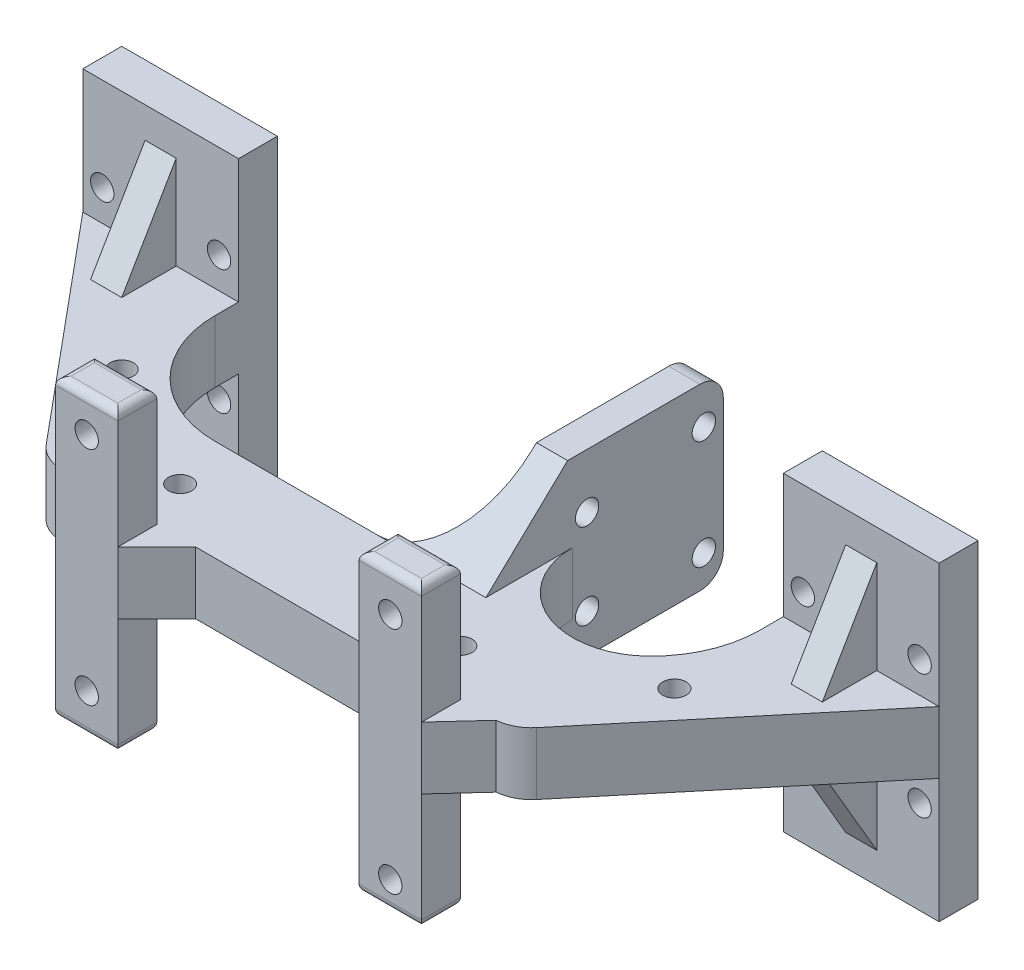
from build123d import *

# Parameters (mm, degrees)
SKETCH_1_W           = 20
SKETCH_1_H           = 39.9
SKETCH_1_R           = 1.5
EXTRUDE_1_DEPTH      = 5
EXTRUDE_1_2_DEPTH    = 5
EXTRUDE_2_DEPTH      = 4
EXTRUDE_2_DEPTH_BACK = 4
FILLET_1_R           = 14
SKETCH_3_R           = 1.5
CUT_EXTRUDE_1_DEPTH  = 11
FILLET_2_R           = 5
SKETCH_4_W           = 4
SKETCH_4_H           = 12
EXTRUDE_3_DEPTH      = 7
CUT_EXTRUDE_2_DEPTH  = 148
EXTRUDE_4_DEPTH      = 4
EXTRUDE_4_DEPTH_BACK = 8
SKETCH_6_W           = 4
SKETCH_6_H           = 30.5
SKETCH_10_W          = 20
SKETCH_10_H          = 6
SKETCH_10_H_2        = 5
EXTRUDE_6_DEPTH      = 4
CUT_EXTRUDE_5_DEPTH  = 6
SKETCH_13_R          = 1.5
CUT_EXTRUDE_6_DEPTH  = 6
EXTRUDE_8_DEPTH      = 4
SKETCH_19_W          = 8
SKETCH_19_H          = 15
SKETCH_19_R          = 1.5
SKETCH_19_H_2        = 8
EXTRUDE_9_DEPTH      = 5
CHAMFER_START        = -4
CHAMFER_1_DEPTH      = 8
FILLET_13_R          = 1
FILLET_14_R          = 10
FILLET_15_R          = 3


with BuildPart() as part:
    # 草图1 → 凸台-拉伸1 (new body)
    with BuildSketch(Plane.XY):
        with Locations((45, 0)):
            Rectangle(SKETCH_1_W, SKETCH_1_H)
        with Locations((37.5, 8)):
            Circle(SKETCH_1_R, mode=Mode.SUBTRACT)
        with Locations(Location((52.5, 8, 0), (0, 0, 180))):
            Circle(SKETCH_1_R, mode=Mode.SUBTRACT)
        with Locations((52.5, -8)):
            Circle(SKETCH_1_R, mode=Mode.SUBTRACT)
        with Locations(Location((37.5, -8, 0), (0, 0, 180))):
            Circle(SKETCH_1_R, mode=Mode.SUBTRACT)
    extrude(amount=EXTRUDE_1_DEPTH)



with BuildPart() as body_2:
    # 草图1 → Extrude 1 2 (new body)
    with BuildSketch(Plane.XY):
        with Locations((-45, 0)):
            Rectangle(SKETCH_1_W, SKETCH_1_H)
        with Locations((-37.5, -8)):
            Circle(SKETCH_1_R, mode=Mode.SUBTRACT)
        with Locations(Location((-52.5, -8, 0), (0, 0, 180))):
            Circle(SKETCH_1_R, mode=Mode.SUBTRACT)
        with Locations((-52.5, 8)):
            Circle(SKETCH_1_R, mode=Mode.SUBTRACT)
        with Locations(Location((-37.5, 8, 0), (0, 0, 180))):
            Circle(SKETCH_1_R, mode=Mode.SUBTRACT)
    extrude(amount=EXTRUDE_1_2_DEPTH)


with BuildPart() as part_1:
    add(part.part)

    add(body_2.part)  # 凸台-拉伸2 merges body 2
    # 草图2 → 凸台-拉伸2 (add, two sides: drawn at the far end of the back side and taken through both)
    with BuildSketch(Plane(origin=(0, 0, 0), x_dir=(1, 0, 0), z_dir=(0, 1, 0)).offset(-EXTRUDE_2_DEPTH_BACK)):
        Polygon((-35, -5), (-55, -5), (-30, -35), (30, -35), (55, -5), (35, -5), (35, -22), (-35, -22), align=None)
    extrude(amount=EXTRUDE_2_DEPTH + EXTRUDE_2_DEPTH_BACK)

    # 圆角1
    fillet_1_edges = [part_1.edges().sort_by_distance(p)[0] for p in [
        (-35, 0, 22),
        (35, 0, 22),
    ]]
    fillet(fillet_1_edges, radius=FILLET_1_R)

    # 草图3 → 切除-拉伸1 (cut)
    with BuildSketch(Plane(origin=(0, 4, 0), x_dir=(1, 0, 0), z_dir=(0, 1, 0))):
        with Locations(Location((17.5, -29, 0), (0, 0, 270))):
            Circle(SKETCH_3_R)
        with Locations(Location((-18.5, -29, 0), (0, 0, 270))):
            Circle(SKETCH_3_R)
        with Locations(Location((-35, -20, 0), (0, 0, 270))):
            Circle(SKETCH_3_R)
        with Locations(Location((36, -20, 0), (0, 0, 270))):
            Circle(SKETCH_3_R)
    extrude(amount=-CUT_EXTRUDE_1_DEPTH, mode=Mode.SUBTRACT)

    # 圆角2
    fillet_2_edges = [part_1.edges().sort_by_distance(p)[0] for p in [
        (30, 0, 35),
        (-30, 0, 35),
    ]]
    fillet(fillet_2_edges, radius=FILLET_2_R)

    # 草图4 → 凸台-拉伸3 (add)
    with BuildSketch(Plane.XY.offset(5)):
        with Locations((-45, 10)):
            Rectangle(SKETCH_4_W, SKETCH_4_H)
        with Locations((-45, -10)):
            Rectangle(SKETCH_4_W, SKETCH_4_H)
        with Locations((45, -10)):
            Rectangle(SKETCH_4_W, SKETCH_4_H)
        with Locations((45, 10)):
            Rectangle(SKETCH_4_W, SKETCH_4_H)
    extrude(amount=EXTRUDE_3_DEPTH)

    # 草图5 → 切除-拉伸2 (cut)
    with BuildSketch(Plane.ZY.offset(47)):
        Polygon((5, 16), (12, 16), (12, 4), align=None)
        Polygon((12, -16), (12, -4), (5, -16), align=None)
    extrude(amount=-CUT_EXTRUDE_2_DEPTH, mode=Mode.SUBTRACT)

    # 草图6 → 凸台-拉伸4 (add, two sides: drawn at the far end of the back side and taken through both)
    with BuildSketch(Plane(origin=(0, 4, 0), x_dir=(1, 0, 0), z_dir=(0, 1, 0)).offset(-EXTRUDE_4_DEPTH_BACK)):
        with Locations((11.78, -6.75)):
            Rectangle(SKETCH_6_W, SKETCH_6_H)
    extrude(amount=EXTRUDE_4_DEPTH + EXTRUDE_4_DEPTH_BACK)

    # 草图10 → 凸台-拉伸6 (add)
    with BuildSketch(Plane(origin=(13.78, 0, 0), x_dir=(0, 0, -1), z_dir=(1, 0, 0))):
        with Locations((-1.5, 11)):
            Rectangle(SKETCH_10_W, SKETCH_10_H)
        with Locations((-1.5, -6.5)):
            Rectangle(SKETCH_10_W, SKETCH_10_H_2)
    extrude(amount=-EXTRUDE_6_DEPTH)

    # 草图11 → 切除-拉伸5 (cut)
    with BuildSketch(Plane.ZY.offset(-9.78)):
        Polygon((17.8, 8), (22, 8), (22, 4), align=None)
    extrude(amount=-CUT_EXTRUDE_5_DEPTH, mode=Mode.SUBTRACT)

    # 草图13 → 切除-拉伸6 (cut)
    with BuildSketch(Plane(origin=(13.78, 0, 0), x_dir=(0, 0, -1), z_dir=(1, 0, 0))):
        with Locations((6, 9)):
            Circle(SKETCH_13_R)
        with Locations((6, -5)):
            Circle(SKETCH_13_R)
        with Locations((-9, 7)):
            Circle(SKETCH_13_R)
        with Locations((-9, -4)):
            Circle(SKETCH_13_R)
    extrude(amount=-CUT_EXTRUDE_6_DEPTH, mode=Mode.SUBTRACT)

    # 草图18 → 凸台-拉伸8 (add)
    with BuildSketch(Plane(origin=(13.78, 0, 0), x_dir=(0, 0, -1), z_dir=(1, 0, 0))):
        Polygon((-11.5, -9), (-11.5, -4), (-22.5, -4), align=None)
        Polygon((-17.8, 8), (-11.5, 14), (-11.5, 8), align=None)
    extrude(amount=-EXTRUDE_8_DEPTH)

    # 草图19 → 凸台-拉伸9 (add)
    # profile 1 of 6: a face of its own
    with BuildSketch(Plane.XY.offset(35)):
        with Locations((-19.5, 11.5)):
            Rectangle(SKETCH_19_W, SKETCH_19_H)
        with Locations((-19.5, 14.5)):
            Circle(SKETCH_19_R, mode=Mode.SUBTRACT)
    # profile 2 of 6: a face of its own
    with BuildSketch(Plane.XY.offset(35)):
        with Locations((-19.5, 0)):
            Rectangle(SKETCH_19_W, SKETCH_19_H_2)
    # profile 3 of 6: a face of its own
    with BuildSketch(Plane.XY.offset(35)):
        with Locations((-19.5, -11.5)):
            Rectangle(SKETCH_19_W, SKETCH_19_H)
        with Locations((-19.5, -14)):
            Circle(SKETCH_19_R, mode=Mode.SUBTRACT)
    # profile 4 of 6: a face of its own
    with BuildSketch(Plane.XY.offset(35)):
        with Locations((19.5, 11.5)):
            Rectangle(SKETCH_19_W, SKETCH_19_H)
        with Locations((19.5, 14)):
            Circle(SKETCH_19_R, mode=Mode.SUBTRACT)
    # profile 5 of 6: a face of its own
    with BuildSketch(Plane.XY.offset(35)):
        with Locations((19.5, 0)):
            Rectangle(SKETCH_19_W, SKETCH_19_H_2)
    # profile 6 of 6: a face of its own
    with BuildSketch(Plane.XY.offset(35)):
        with Locations((19.5, -11.5)):
            Rectangle(SKETCH_19_W, SKETCH_19_H)
        with Locations((19.5, -15.5)):
            Circle(SKETCH_19_R, mode=Mode.SUBTRACT)
    extrude(amount=EXTRUDE_9_DEPTH)

    # 倒角1: read off the stored shape, not the designer's step
    # 倒角1 outline → 倒角1 (add)
    with BuildSketch(Plane(origin=(0, 0, 0), x_dir=(1, 0, 0), z_dir=(0, 1, 0)).offset(CHAMFER_START)):
        with BuildLine():
            Line((23.5, -39.964499332), (28.079062635, -34.982249666))
            ThreePointArc((28.079062635, -34.982249666), (27.868780996, -34.995560446), (27.65812527, -35))
            Line((27.65812527, -35), (23.5, -35))
            Line((23.5, -35), (23.5, -39.964499332))
        make_face()
        with BuildLine():
            Line((-28.079062635, -34.982249666), (-23.5, -39.964499332))
            Line((-23.5, -39.964499332), (-23.5, -35))
            Line((-23.5, -35), (-27.65812527, -35))
            ThreePointArc((-27.65812527, -35), (-27.868780996, -34.995560446), (-28.079062635, -34.982249666))
        make_face()
        Polygon((15.5, -35), (10.5, -35), (15.5, -40), align=None)
        Polygon((-15.5, -40), (-10.5, -35), (-15.5, -35), align=None)
    extrude(amount=CHAMFER_1_DEPTH)

    # 圆角13
    fillet_13_edges = [part_1.edges().sort_by_distance(p)[0] for p in [
        (-19.5, -19, 35),
        (-19.5, 19, 35),
        (-15.5, 19, 37.5),
        (-23.5, 19, 37.5),
        (-19.5, -19, 40),
        (-23.5, -19, 37.5),
        (-15.5, -19, 37.5),
        (-19.5, 19, 40),
        (15.5, 19, 37.5),
        (19.5, -19, 35),
        (15.5, -19, 37.5),
        (23.5, -19, 37.5),
        (19.5, 19, 40),
        (23.5, 19, 37.5),
        (19.5, -19, 40),
        (19.5, 19, 35),
    ]]
    fillet(fillet_13_edges, radius=FILLET_13_R)

    # 圆角14
    # the kernel refuses this fillet: 10 mm, written as the material it adds along each edge
    with BuildSketch(Plane(origin=(13.78, -4, 22), x_dir=(0.9741093226814803, 0, -0.2260774811099678), z_dir=(0, 1, 0))) as fillet_14_piece_1:
        with BuildLine():
            CenterArc((12.255970323, 8.57517936), FILLET_14_R, 166.93375399, 134.02721721)
            Line((2.514877096, 10.835954171), (1.540767773, 11.062031652))
            Line((1.540767773, 11.062031652), (-0.974109323, 0.226077481))
            Line((-0.974109323, 0.226077481), (-0.226077481, -0.974109323))
            ThreePointArc((-0.226077481, -0.974109323), (6.806991829, -2.606388736), (17.914965085, -0.857517936))
            Line((17.914965085, -0.857517936), (17.400511016, 0))
        make_face()
    extrude(amount=8)
    with BuildSketch(Plane(origin=(9.78, -4, 22), x_dir=(-1, 0, 0), z_dir=(0, 1, 0))) as fillet_14_piece_2_section:
        with BuildLine():
            CenterArc((FILLET_14_R, -FILLET_14_R), FILLET_14_R, 90, 90)
            Line((0, -FILLET_14_R), (0, 0))
            Line((0, 0), (FILLET_14_R, 0))
        make_face()
    fillet_14_piece_2 = extrude(amount=8, mode=Mode.PRIVATE)
    fillet_14_piece_2 = split(fillet_14_piece_2, bisect_by=Plane(origin=(9.78, 0.195005945, 25.995243757), z_dir=(0, -0.7241379310344828, -0.6896551724137933)), keep=Keep.TOP, mode=Mode.PRIVATE)
    add(fillet_14_piece_2)
    with BuildSketch(Plane(origin=(9.78, -4, 22), x_dir=(-1, 0, 0), z_dir=(0, 1, 0))) as fillet_14_piece_3_section:
        with BuildLine():
            CenterArc((FILLET_14_R, -FILLET_14_R), FILLET_14_R, 90, 90)
            Line((0, -FILLET_14_R), (0, 0))
            Line((0, 0), (FILLET_14_R, 0))
        make_face()
    fillet_14_piece_3 = extrude(amount=33, mode=Mode.PRIVATE)
    fillet_14_piece_3 = split(fillet_14_piece_3, bisect_by=Plane(origin=(9.78, 4, 22), z_dir=(0, 1, 0)), keep=Keep.TOP, mode=Mode.PRIVATE)
    fillet_14_piece_3 = split(fillet_14_piece_3, bisect_by=Plane(origin=(9.78, 0.195005945, 25.995243757), z_dir=(0, -0.7241379310344828, -0.6896551724137933)), keep=Keep.TOP, mode=Mode.PRIVATE)
    add(fillet_14_piece_3)

    # 圆角15
    fillet_15_edges = [part_1.edges().sort_by_distance(p)[0] for p in [
        (11.78, 14, -8.5),
        (11.78, -9, -8.5),
    ]]
    fillet(fillet_15_edges, radius=FILLET_15_R)


solid = part_1.part
